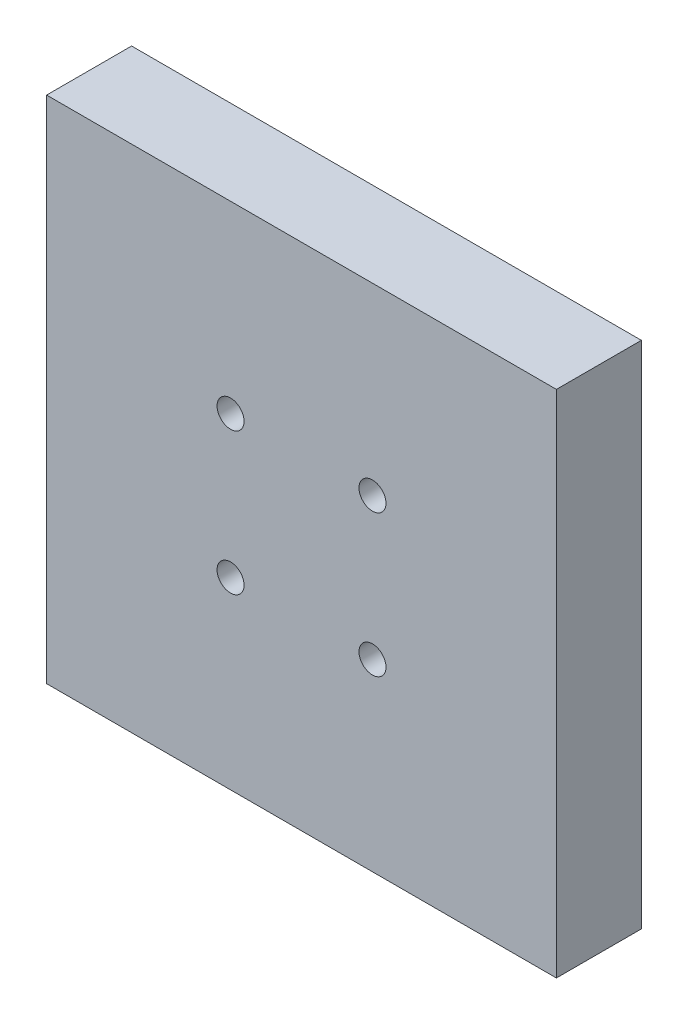
from build123d import *

# Parameters (mm, degrees)
BOSS_EXTRUDE1_DEPTH = 12.7
SKETCH2_R           = 2.0193
CUT_EXTRUDE1_DEPTH  = 56.358016583


with BuildPart() as part:
    # Sketch1 → Boss-Extrude1 (new body)
    with BuildSketch(Plane.XY):
        Polygon((-38.1, 38.1), (-38.1, -38.1), (-12.7, -38.1), (12.7, -38.1), (38.1, -38.1), (38.1, 38.1), (12.7, 38.1), (-12.7, 38.1), align=None)
    extrude(amount=BOSS_EXTRUDE1_DEPTH)

    # Sketch2 → Cut-Extrude1 (cut, through all)
    with BuildSketch(Plane.XY.offset(12.7)):
        with Locations((10.606601718, 10.606601718)):
            Circle(SKETCH2_R)
        with Locations((10.606601718, -10.606601718)):
            Circle(SKETCH2_R)
        with Locations((-10.606601718, -10.606601718)):
            Circle(SKETCH2_R)
        with Locations((-10.606601718, 10.606601718)):
            Circle(SKETCH2_R)
    extrude(amount=-CUT_EXTRUDE1_DEPTH, mode=Mode.SUBTRACT)


solid = part.part
